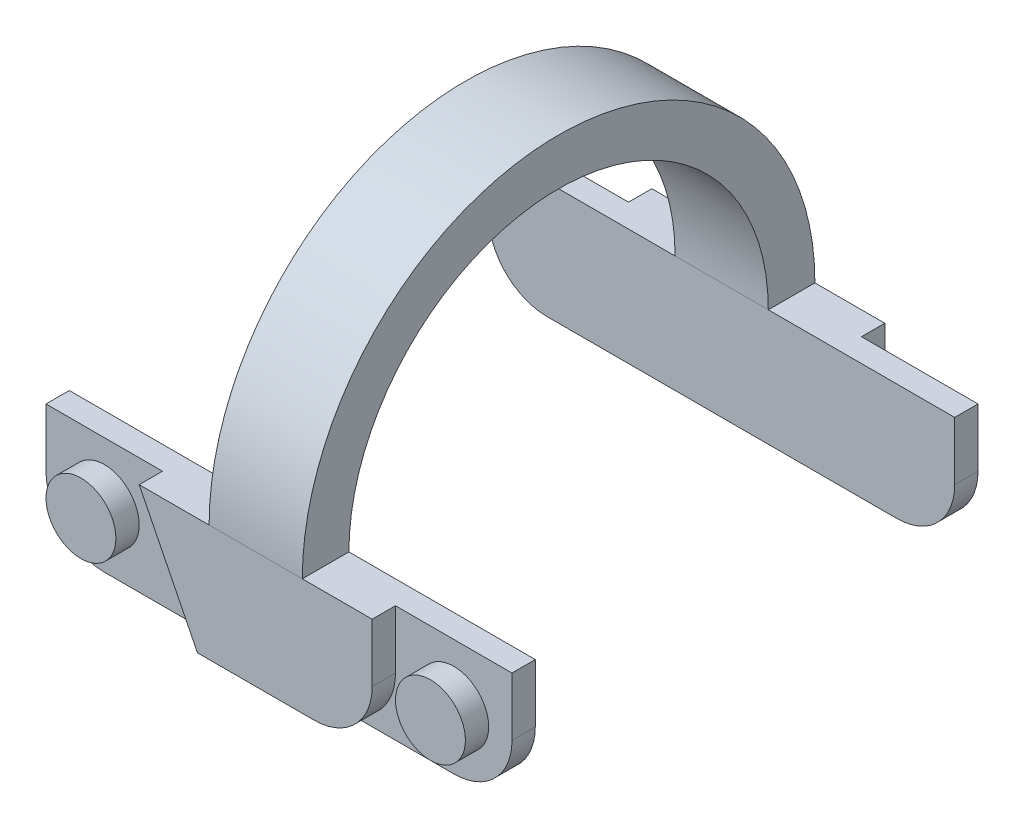
from build123d import *

# Parameters (mm, degrees)
SKETCH3_W             = 2
SKETCH3_H             = 5
BOSS_EXTRUDE1_DEPTH   = 20
BOSS_EXTRUDE1_2_DEPTH = 20
SKETCH4_W             = 5
SKETCH4_H             = 5
CUT_EXTRUDE1_DEPTH    = 1
SKETCH5_W             = 5
SKETCH5_H             = 5
CUT_EXTRUDE2_DEPTH    = 1
SWEEP1_START          = 8
SWEEP1_DEPTH          = 4
SKETCH7_R             = 1.5
BOSS_EXTRUDE2_DEPTH   = 1
BOSS_EXTRUDE3_START   = 1
SKETCH8_R             = 1.5
BOSS_EXTRUDE3_DEPTH   = 1
FILLET1_R             = 2.5
CUT_EXTRUDE3_DEPTH    = 1
CUT_EXTRUDE4_DEPTH    = 1
FILLET2_R             = 2.5


# Read off the part's stored shape, not the designer's step: Sweep1
with BuildPart() as part:
    # Sketch3 → Boss-Extrude1 (new body)
    with BuildSketch(Plane(origin=(0, 0, 0), x_dir=(0, 0, -1), z_dir=(1, 0, 0))):
        with Locations((-10, 0)):
            Rectangle(SKETCH3_W, SKETCH3_H)
    extrude(amount=BOSS_EXTRUDE1_DEPTH)

    # Sketch4 → Cut-Extrude1 (cut)
    with BuildSketch(Plane.XY.offset(11)):
        with Locations((2.5, 0)):
            Rectangle(SKETCH4_W, SKETCH4_H)
        with Locations((17.5, 0)):
            Rectangle(SKETCH4_W, SKETCH4_H)
    extrude(amount=-CUT_EXTRUDE1_DEPTH, mode=Mode.SUBTRACT)



with BuildPart() as body_2:
    # Sketch3 → Boss-Extrude1 2 (new body)
    with BuildSketch(Plane(origin=(0, 0, 0), x_dir=(0, 0, -1), z_dir=(1, 0, 0))):
        with Locations((10, 0)):
            Rectangle(SKETCH3_W, SKETCH3_H)
    extrude(amount=BOSS_EXTRUDE1_2_DEPTH)

    # Sketch5 → Cut-Extrude2 (cut)
    with BuildSketch(Plane(origin=(0, 0, -11), x_dir=(-1, 0, 0), z_dir=(0, 0, -1))):
        with Locations((-17.5, 0)):
            Rectangle(SKETCH5_W, SKETCH5_H)
        with Locations((-2.5, 0)):
            Rectangle(SKETCH5_W, SKETCH5_H)
    extrude(amount=-CUT_EXTRUDE2_DEPTH, mode=Mode.SUBTRACT)


with BuildPart() as part_1:
    add(part.part)

    add(body_2.part)  # Sweep1 merges body 2
    # Sweep1 outline → Sweep1 (add)
    with BuildSketch(Plane.YZ.offset(SWEEP1_START)):
        with BuildLine():
            Line((2.5, -9), (2.5, -11))
            ThreePointArc((2.5, -11), (13.5, 0), (2.5, 11))
            Line((2.5, 11), (2.5, 9))
            ThreePointArc((2.5, 9), (11.5, 0), (2.5, -9))
        make_face()
    extrude(amount=SWEEP1_DEPTH)

    # Sketch7 → Boss-Extrude2 (add)
    with BuildSketch(Plane(origin=(0, 0, -10), x_dir=(-1, 0, 0), z_dir=(0, 0, -1))):
        with Locations(Location((-2.5, 0, 0), (0, 0, 270))):
            Circle(SKETCH7_R)
        with Locations(Location((-17.5, 0, 0), (0, 0, 90))):
            Circle(SKETCH7_R)
    extrude(amount=BOSS_EXTRUDE2_DEPTH)

    # Sketch8 → Boss-Extrude3 (add)
    with BuildSketch(Plane.XY.offset(10).offset(BOSS_EXTRUDE3_START)):
        with Locations(Location((17.5, 0, 0), (0, 0, 90))):
            Circle(SKETCH8_R)
        with Locations(Location((2.5, 0, 0), (0, 0, 270))):
            Circle(SKETCH8_R)
    extrude(amount=-BOSS_EXTRUDE3_DEPTH)

    # Fillet1
    fillet1_edges = [part_1.edges().sort_by_distance(p)[0] for p in [
        (0, -2.5, 9.5),
        (20, -2.5, 9.5),
        (20, -2.5, -9.5),
        (0, -2.5, -9.5),
    ]]
    fillet(fillet1_edges, radius=FILLET1_R)

    # Sketch9 → Cut-Extrude3 (cut)
    with BuildSketch(Plane.XY.offset(11)):
        Polygon((5, 2.5), (7.5, -2.5), (5, -2.5), align=None)
    extrude(amount=-CUT_EXTRUDE3_DEPTH, mode=Mode.SUBTRACT)

    # Sketch10 → Cut-Extrude4 (cut)
    with BuildSketch(Plane(origin=(0, 0, -11), x_dir=(-1, 0, 0), z_dir=(0, 0, -1))):
        Polygon((-5, 2.5), (-7.5, -2.5), (-5, -2.5), align=None)
    extrude(amount=-CUT_EXTRUDE4_DEPTH, mode=Mode.SUBTRACT)

    # Fillet2
    fillet2_edges = [part_1.edges().sort_by_distance(p)[0] for p in [
        (15, -2.5, 10.5),
        (15, -2.5, -10.5),
    ]]
    fillet(fillet2_edges, radius=FILLET2_R)


solid = part_1.part
